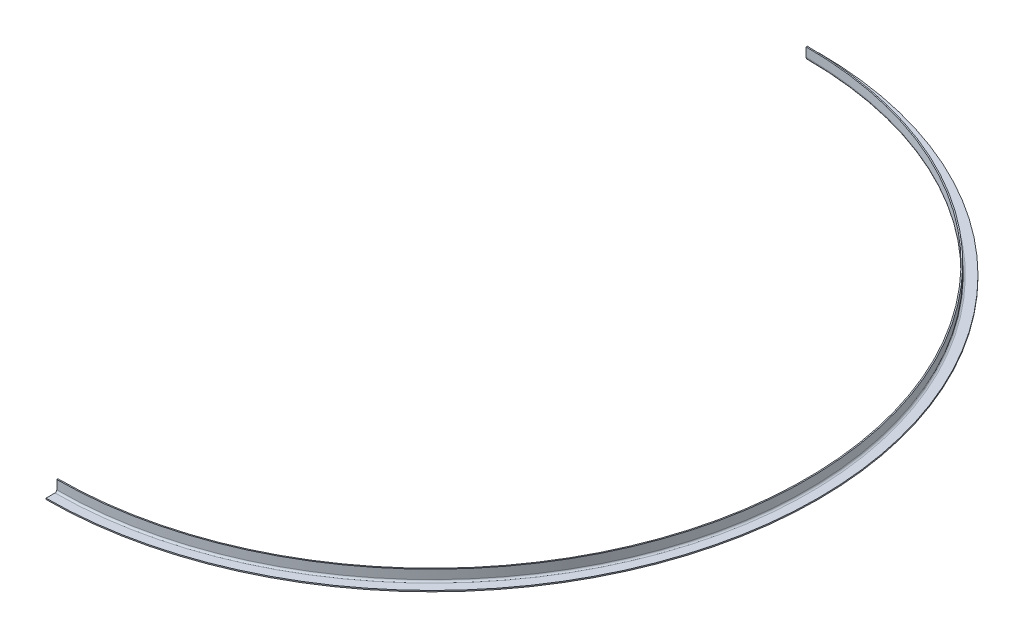
from build123d import *

# Parameters (mm, degrees)
BASE_FLANGE1_DEPTH   = 4
EDGE_FLANGE1_ANGLE   = 180
EDGE_FLANGE1_2_ANGLE = 180


# Read off the part's stored shape, not the designer's step: Edge-Flange1
# Sheet-metal steps are written as plain solids
with BuildPart() as part:
    # Sketch1 → Base-Flange1 (new body)
    with BuildSketch(Plane(origin=(0, 0, 0), x_dir=(1, 0, 0), z_dir=(0, 1, 0))):
        with BuildLine():
            Line((0, 1290), (0, 1250))
            ThreePointArc((0, 1250), (1250, 0), (0, -1250))
            Line((0, -1250), (0, -1290))
            ThreePointArc((0, -1290), (1290, 0), (0, 1290))
        make_face()
    extrude(amount=-BASE_FLANGE1_DEPTH)

    # Edge-Flange1 outline → Edge-Flange1 (revolve, cut)
    with BuildSketch(Plane.ZY):
        with BuildLine():
            Line((1252, 0), (1250, 0))
            Line((1250, 0), (1250, -4))
            Line((1250, -4), (1260, -4))
            ThreePointArc((1260, -4), (1255.527864045, -2.94427191), (1252, 0))
        make_face()
    revolve(axis=Axis((0, 0, 0), (0, 1, 0)), revolution_arc=EDGE_FLANGE1_ANGLE, mode=Mode.SUBTRACT)

    # Edge-Flange1 2 outline → Edge-Flange1 2 (revolve)
    with BuildSketch(Plane.ZY):
        with BuildLine():
            Line((1254, 36), (1250, 36))
            Line((1250, 36), (1250, 6))
            ThreePointArc((1250, 6), (1250.513167019, 2.83772234), (1252, 0))
            Line((1252, 0), (1260, 0))
            ThreePointArc((1260, 0), (1255.757359313, 1.757359313), (1254, 6))
            Line((1254, 6), (1254, 36))
        make_face()
    revolve(axis=Axis((0, 0, 0), (0, 1, 0)), revolution_arc=EDGE_FLANGE1_2_ANGLE)


solid = part.part
